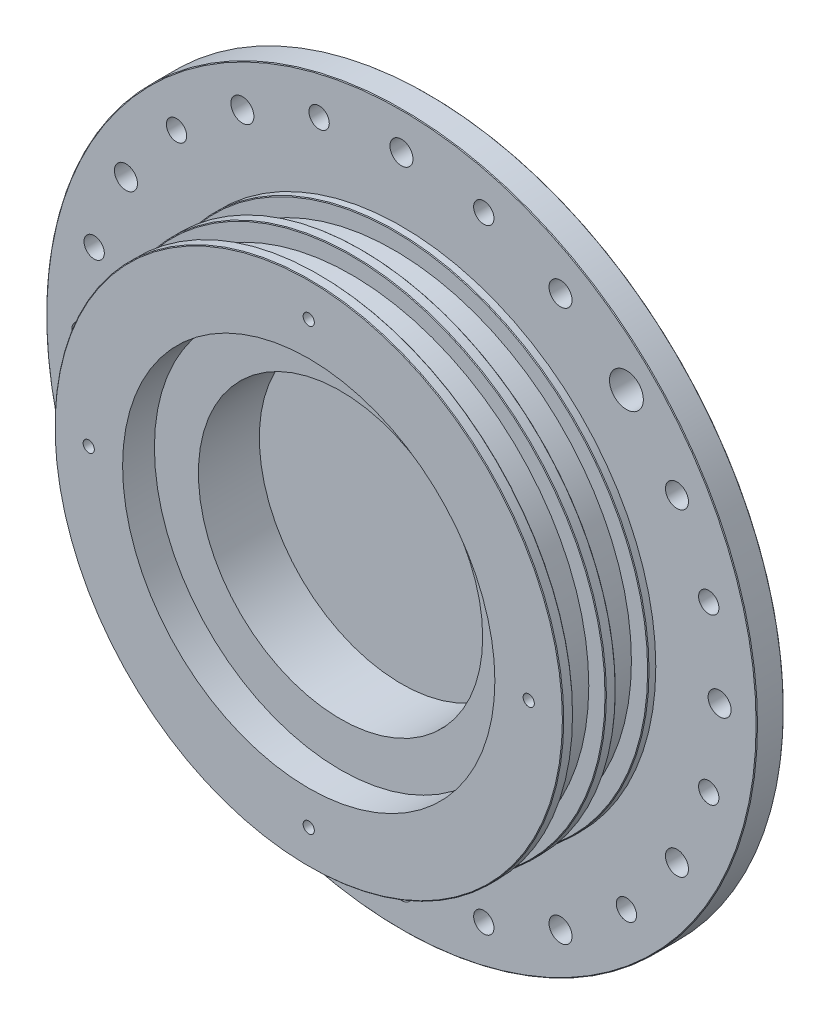
from build123d import *

# Parameters (mm, degrees)
DIAM_TRE_DU_PER_AGE_9_0_9_1_D     = 9
DIAM_TRE_DU_PER_AGE_9_0_9_1_DEPTH = 3
TROU_TARAUD_M4X0_71_D             = 3.3
TROU_TARAUD_M4X0_71_DEPTH         = 15
R_P_TITION_CIRCULAIRE3_COUNT      = 4
D_GAGEMENT_M1001_D                = 110
D_GAGEMENT_M1001_DEPTH            = 27.4
ESQUISSE8_R                       = 105
ESQUISSE8_R_2                     = 77.5
BOSS_EXTRU_1_DEPTH                = 8
ESQUISSE35_R                      = 55
ESQUISSE35_R_2                    = 42
BOSS_EXTRU_4_DEPTH                = 18
TROU_TARAUD_M8X1_251_D            = 6.8
TROU_TARAUD_M8X1_251_DEPTH        = 20
R_P_TITION_CIRCULAIRE2_COUNT      = 12
ENL_V_MAT_EXTRU_15_DEPTH          = 153.653725798
ENL_V_MAT_EXTRU_15_DEPTH_BACK     = 153.653725798
ESQUISSE24_R                      = 3
ESQUISSE24_R_2                    = 5.1
ESQUISSE24_R_3                    = 5
CHANFREIN1_SIZE                   = 0.2
ENL_V_MAT_EXTRU_18_DEPTH          = 2
BOSS_EXTRU_5_START                = -5
ESQUISSE36_R                      = 5.1
BOSS_EXTRU_5_DEPTH                = 5
R_P_TITION_CIRCULAIRE1_COUNT      = 8


with BuildPart() as part:
    # Esquisse1 → Révolution1 (revolve)
    with BuildSketch(Plane(origin=(0, 0, 0), x_dir=(1, 0, 0), z_dir=(0, 1, 0))):
        Polygon((87.5, 35.4), (0, 35.4), (0, 0), (75.15, 0), (75.15, 3), (70.15, 3), (70.15, 12.6), (75.15, 12.6), (75.15, 15.6), (70.15, 15.6), (70.15, 25.2), (75.15, 25.2), (75.15, 27.4), (87.5, 27.4), align=None)
    revolve(axis=Axis((0, 0, -35.4), (0, 0, 1)))

    # Diamètre du perçage Ø9.0 (9)1
    with Locations(Plane.XY.offset(-27.4)):
        with Locations((-87.5, 0), (0, 87.5), (0, -87.5), (87.5, 0)):
            Hole(DIAM_TRE_DU_PER_AGE_9_0_9_1_D / 2, depth=DIAM_TRE_DU_PER_AGE_9_0_9_1_DEPTH)

    # Trou taraudé M4x0.71
    with Locations(Plane.XY):
        with Locations((0, 65)):
            trou_taraud_m4x0_71 = Hole(TROU_TARAUD_M4X0_71_D / 2, depth=TROU_TARAUD_M4X0_71_DEPTH)

    # Répétition circulaire3: Trou taraudé M4x0.71 ×4 about axis
    r_p_tition_circulaire3_axis = Axis((0, 0, -35.4), (0, 0, 1))
    for i in range(1, R_P_TITION_CIRCULAIRE3_COUNT):
        add(trou_taraud_m4x0_71.rotate(r_p_tition_circulaire3_axis, i * 360 / R_P_TITION_CIRCULAIRE3_COUNT), mode=Mode.SUBTRACT)

    # Dégagement M1001
    with Locations(Plane.XY):
        with Locations((0, 0)):
            Hole(D_GAGEMENT_M1001_D / 2, depth=D_GAGEMENT_M1001_DEPTH)

    # Esquisse8 → Boss.-Extru.1 (add)
    with BuildSketch(Plane(origin=(0, 0, -35.4), x_dir=(-1, 0, 0), z_dir=(0, 0, -1))):
        Circle(ESQUISSE8_R)
        Circle(ESQUISSE8_R_2, mode=Mode.SUBTRACT)
    extrude(amount=-BOSS_EXTRU_1_DEPTH)

    # Esquisse35 → Boss.-Extru.4 (add)
    with BuildSketch(Plane.XY.offset(-27.4)):
        Circle(ESQUISSE35_R)
        Circle(ESQUISSE35_R_2, mode=Mode.SUBTRACT)
    extrude(amount=BOSS_EXTRU_4_DEPTH)

    # Trou taraudé M8x1.251
    with Locations(Plane(origin=(0, 0, -35.4), x_dir=(-1, 0, 0), z_dir=(0, 0, -1))):
        with Locations((0, -94), (0, -50)):
            trou_taraud_m8x1_251 = Hole(TROU_TARAUD_M8X1_251_D / 2, depth=TROU_TARAUD_M8X1_251_DEPTH)

    # Répétition circulaire2: Trou taraudé M8x1.251 ×12 about axis
    r_p_tition_circulaire2_axis = Axis((0, 0, -35.4), (0, 0, -1))
    for i in range(1, R_P_TITION_CIRCULAIRE2_COUNT):
        add(trou_taraud_m8x1_251.rotate(r_p_tition_circulaire2_axis, i * 360 / R_P_TITION_CIRCULAIRE2_COUNT), mode=Mode.SUBTRACT)

    # Esquisse24 → Enlèv. mat.-Extru.15 (cut, two sides: drawn at the far end of the back side and taken through both)
    with BuildSketch(Plane(origin=(0, 0, -35.4), x_dir=(-1, 0, 0), z_dir=(0, 0, -1)).offset(-ENL_V_MAT_EXTRU_15_DEPTH_BACK)):
        with Locations((24.32899024, 90.797027671)):
            Circle(ESQUISSE24_R)
        with Locations((66.468037432, 66.468037432)):
            Circle(ESQUISSE24_R)
        with Locations((90.797027671, 24.32899024)):
            Circle(ESQUISSE24_R)
        with Locations((90.797027671, -24.32899024)):
            Circle(ESQUISSE24_R)
        with Locations((-14, 24.248711306)):
            Circle(ESQUISSE24_R_2)
        with Locations((7.246933263, 27.045923136)):
            Circle(ESQUISSE24_R_2)
        with Locations((24.248711306, 14)):
            Circle(ESQUISSE24_R_2)
        with Locations((27.045923136, -7.246933263)):
            Circle(ESQUISSE24_R_2)
        with Locations((14, -24.248711306)):
            Circle(ESQUISSE24_R_2)
        with Locations((-7.246933263, -27.045923136)):
            Circle(ESQUISSE24_R_2)
        with Locations((-24.248711306, -14)):
            Circle(ESQUISSE24_R_2)
        with Locations((-27.045923136, 7.246933263)):
            Circle(ESQUISSE24_R_2)
        with Locations((-66.468037432, 66.468037432)):
            Circle(ESQUISSE24_R_3)
        with Locations((66.468037432, -66.468037432)):
            Circle(ESQUISSE24_R)
        with Locations((24.32899024, -90.797027671)):
            Circle(ESQUISSE24_R)
        with Locations((-24.32899024, -90.797027671)):
            Circle(ESQUISSE24_R)
        with Locations((-66.468037432, -66.468037432)):
            Circle(ESQUISSE24_R)
        with Locations((-90.797027671, -24.32899024)):
            Circle(ESQUISSE24_R)
        with Locations((-90.797027671, 24.32899024)):
            Circle(ESQUISSE24_R)
        with Locations((-24.32899024, 90.797027671)):
            Circle(ESQUISSE24_R)
        Circle(ESQUISSE24_R_2)
    extrude(amount=ENL_V_MAT_EXTRU_15_DEPTH + ENL_V_MAT_EXTRU_15_DEPTH_BACK, mode=Mode.SUBTRACT)

    # Chanfrein1
    chanfrein1_edges = [part.edges().sort_by_distance(p)[0] for p in [
        (-75.15, 0, -25.2),
        (-75.15, 0, -3),
        (-75.15, 0, -12.6),
        (-75.15, 0, -15.6),
        (105, 0, -35.4),
        (105, 0, -27.4),
        (-75.15, 0, 0),
    ]]
    chamfer(chanfrein1_edges, length=CHANFREIN1_SIZE)

    # Esquisse25 → Enlèv. mat.-Extru.18 (cut)
    with BuildSketch(Plane(origin=(0, 0, -35.4), x_dir=(-1, 0, 0), z_dir=(0, 0, -1))):
        with BuildLine():
            Line((-10.1, 3.137845559), (-10.1, -3.137845559))
            ThreePointArc((-10.1, -3.137845559), (-10.1, -4.604345773), (-9.404868295, -5.895629937))
            ThreePointArc((-9.404868295, -5.895629937), (0, -11.1), (9.404868295, -5.895629937))
            ThreePointArc((9.404868295, -5.895629937), (10.1, -4.604345773), (10.1, -3.137845559))
            Line((10.1, -3.137845559), (10.1, 3.137845559))
            ThreePointArc((10.1, 3.137845559), (10.1, 4.604345773), (9.404868295, 5.895629937))
            ThreePointArc((9.404868295, 5.895629937), (0, 11.1), (-9.404868295, 5.895629937))
            ThreePointArc((-9.404868295, 5.895629937), (-10.1, 4.604345773), (-10.1, 3.137845559))
        make_face()
        with BuildLine():
            Line((-22.534674305, 14.423884843), (-27.364303436, 15.717980069))
            ThreePointArc((-27.364303436, 15.717980069), (-27.626062148, 15.80113362), (-27.879119212, 15.907877515))
            ThreePointArc((-27.879119212, 15.907877515), (-29.43732897, 16.188098003), (-30.921195595, 15.636118826))
            ThreePointArc((-30.921195595, 15.636118826), (-31.100803738, 15.516590499), (-31.288537773, 15.410279455))
            ThreePointArc((-31.288537773, 15.410279455), (-35.932440738, 9.628068478), (-34.801808286, 2.298575399))
            ThreePointArc((-34.801808286, 2.298575399), (-34.692381365, 2.112640317), (-34.596600313, 1.919321678))
            ThreePointArc((-34.596600313, 1.919321678), (-33.587523709, 0.699360376), (-32.09796423, 0.162933558))
            ThreePointArc((-32.09796423, 0.162933558), (-31.825438437, 0.128847951), (-31.557171967, 0.069981683))
            Line((-31.557171967, 0.069981683), (-26.727542836, -1.224113543))
            ThreePointArc((-26.727542836, -1.224113543), (-26.465784124, -1.307267094), (-26.212727061, -1.414010989))
            ThreePointArc((-26.212727061, -1.414010989), (-24.654517302, -1.694231477), (-23.170650678, -1.1422523))
            ThreePointArc((-23.170650678, -1.1422523), (-22.991042534, -1.022723973), (-22.803308499, -0.916412929))
            ThreePointArc((-22.803308499, -0.916412929), (-18.159405534, 4.865798048), (-19.290037986, 12.195291126))
            ThreePointArc((-19.290037986, 12.195291126), (-19.399464908, 12.381226209), (-19.495245959, 12.574544848))
            ThreePointArc((-19.495245959, 12.574544848), (-20.504322564, 13.79450615), (-21.993882042, 14.330932968))
            ThreePointArc((-21.993882042, 14.330932968), (-22.266407835, 14.365018575), (-22.534674305, 14.423884843))
        make_face()
        with BuildLine():
            Line((-5.735194229, 26.133647797), (-8.235194229, 30.463774815))
            ThreePointArc((-8.235194229, 30.463774815), (-8.36148715, 30.707664616), (-8.464946183, 30.962082313))
            ThreePointArc((-8.464946183, 30.962082313), (-9.368621062, 32.262048807), (-10.808181434, 32.92099274))
            ThreePointArc((-10.808181434, 32.92099274), (-11.019702861, 32.963475586), (-11.22762413, 33.021050335))
            ThreePointArc((-11.22762413, 33.021050335), (-18.6, 32.216145021), (-22.983256384, 26.233932888))
            ThreePointArc((-22.983256384, 26.233932888), (-23.037355824, 26.025080413), (-23.106325314, 25.820656061))
            ThreePointArc((-23.106325314, 25.820656061), (-23.255443313, 24.244488242), (-22.581476746, 22.811899593))
            ThreePointArc((-22.581476746, 22.811899593), (-22.412874073, 22.595092593), (-22.264805771, 22.363774815))
            Line((-22.264805771, 22.363774815), (-19.764805771, 18.033647797))
            ThreePointArc((-19.764805771, 18.033647797), (-19.63851285, 17.789757996), (-19.535053817, 17.535340299))
            ThreePointArc((-19.535053817, 17.535340299), (-18.631378938, 16.235373805), (-17.191818566, 15.576429871))
            ThreePointArc((-17.191818566, 15.576429871), (-16.980297139, 15.533947026), (-16.77237587, 15.476372277))
            ThreePointArc((-16.77237587, 15.476372277), (-9.4, 16.281277591), (-5.016743616, 22.263489724))
            ThreePointArc((-5.016743616, 22.263489724), (-4.962644176, 22.472342199), (-4.893674686, 22.676766551))
            ThreePointArc((-4.893674686, 22.676766551), (-4.744556687, 24.25293437), (-5.418523254, 25.685523019))
            ThreePointArc((-5.418523254, 25.685523019), (-5.587125927, 25.902330019), (-5.735194229, 26.133647797))
        make_face()
        with BuildLine():
            Line((14.423884843, 22.534674305), (15.717980069, 27.364303436))
            ThreePointArc((15.717980069, 27.364303436), (15.80113362, 27.626062148), (15.907877515, 27.879119212))
            ThreePointArc((15.907877515, 27.879119212), (16.188098003, 29.43732897), (15.636118826, 30.921195595))
            ThreePointArc((15.636118826, 30.921195595), (15.516590499, 31.100803738), (15.410279455, 31.288537773))
            ThreePointArc((15.410279455, 31.288537773), (9.628068478, 35.932440738), (2.298575399, 34.801808286))
            ThreePointArc((2.298575399, 34.801808286), (2.112640317, 34.692381365), (1.919321678, 34.596600313))
            ThreePointArc((1.919321678, 34.596600313), (0.699360376, 33.587523709), (0.162933558, 32.09796423))
            ThreePointArc((0.162933558, 32.09796423), (0.128847951, 31.825438437), (0.069981683, 31.557171967))
            Line((0.069981683, 31.557171967), (-1.224113543, 26.727542836))
            ThreePointArc((-1.224113543, 26.727542836), (-1.307267094, 26.465784124), (-1.414010989, 26.212727061))
            ThreePointArc((-1.414010989, 26.212727061), (-1.694231477, 24.654517302), (-1.1422523, 23.170650678))
            ThreePointArc((-1.1422523, 23.170650678), (-1.022723973, 22.991042534), (-0.916412929, 22.803308499))
            ThreePointArc((-0.916412929, 22.803308499), (4.865798048, 18.159405534), (12.195291126, 19.290037986))
            ThreePointArc((12.195291126, 19.290037986), (12.381226209, 19.399464908), (12.574544848, 19.495245959))
            ThreePointArc((12.574544848, 19.495245959), (13.79450615, 20.504322564), (14.330932968, 21.993882042))
            ThreePointArc((14.330932968, 21.993882042), (14.365018575, 22.266407835), (14.423884843, 22.534674305))
        make_face()
        with BuildLine():
            Line((26.133647797, 5.735194229), (30.463774815, 8.235194229))
            ThreePointArc((30.463774815, 8.235194229), (30.707664616, 8.36148715), (30.962082313, 8.464946183))
            ThreePointArc((30.962082313, 8.464946183), (32.262048807, 9.368621062), (32.92099274, 10.808181434))
            ThreePointArc((32.92099274, 10.808181434), (32.963475586, 11.019702861), (33.021050335, 11.22762413))
            ThreePointArc((33.021050335, 11.22762413), (32.216145021, 18.6), (26.233932888, 22.983256384))
            ThreePointArc((26.233932888, 22.983256384), (26.025080413, 23.037355824), (25.820656061, 23.106325314))
            ThreePointArc((25.820656061, 23.106325314), (24.244488242, 23.255443313), (22.811899593, 22.581476746))
            ThreePointArc((22.811899593, 22.581476746), (22.595092593, 22.412874073), (22.363774815, 22.264805771))
            Line((22.363774815, 22.264805771), (18.033647797, 19.764805771))
            ThreePointArc((18.033647797, 19.764805771), (17.789757996, 19.63851285), (17.535340299, 19.535053817))
            ThreePointArc((17.535340299, 19.535053817), (16.235373805, 18.631378938), (15.576429871, 17.191818566))
            ThreePointArc((15.576429871, 17.191818566), (15.533947026, 16.980297139), (15.476372277, 16.77237587))
            ThreePointArc((15.476372277, 16.77237587), (16.281277591, 9.4), (22.263489724, 5.016743616))
            ThreePointArc((22.263489724, 5.016743616), (22.472342199, 4.962644176), (22.676766551, 4.893674686))
            ThreePointArc((22.676766551, 4.893674686), (24.25293437, 4.744556687), (25.685523019, 5.418523254))
            ThreePointArc((25.685523019, 5.418523254), (25.902330019, 5.587125927), (26.133647797, 5.735194229))
        make_face()
        with BuildLine():
            Line((22.534674305, -14.423884843), (27.364303436, -15.717980069))
            ThreePointArc((27.364303436, -15.717980069), (27.626062148, -15.80113362), (27.879119212, -15.907877515))
            ThreePointArc((27.879119212, -15.907877515), (29.43732897, -16.188098003), (30.921195595, -15.636118826))
            ThreePointArc((30.921195595, -15.636118826), (31.100803738, -15.516590499), (31.288537773, -15.410279455))
            ThreePointArc((31.288537773, -15.410279455), (35.932440738, -9.628068478), (34.801808286, -2.298575399))
            ThreePointArc((34.801808286, -2.298575399), (34.692381365, -2.112640317), (34.596600313, -1.919321678))
            ThreePointArc((34.596600313, -1.919321678), (33.587523709, -0.699360376), (32.09796423, -0.162933558))
            ThreePointArc((32.09796423, -0.162933558), (31.825438437, -0.128847951), (31.557171967, -0.069981683))
            Line((31.557171967, -0.069981683), (26.727542836, 1.224113543))
            ThreePointArc((26.727542836, 1.224113543), (26.465784124, 1.307267094), (26.212727061, 1.414010989))
            ThreePointArc((26.212727061, 1.414010989), (24.654517302, 1.694231477), (23.170650678, 1.1422523))
            ThreePointArc((23.170650678, 1.1422523), (22.991042534, 1.022723973), (22.803308499, 0.916412929))
            ThreePointArc((22.803308499, 0.916412929), (18.159405534, -4.865798048), (19.290037986, -12.195291126))
            ThreePointArc((19.290037986, -12.195291126), (19.399464908, -12.381226209), (19.495245959, -12.574544848))
            ThreePointArc((19.495245959, -12.574544848), (20.504322564, -13.79450615), (21.993882042, -14.330932968))
            ThreePointArc((21.993882042, -14.330932968), (22.266407835, -14.365018575), (22.534674305, -14.423884843))
        make_face()
        with BuildLine():
            Line((5.735194229, -26.133647797), (8.235194229, -30.463774815))
            ThreePointArc((8.235194229, -30.463774815), (8.36148715, -30.707664616), (8.464946183, -30.962082313))
            ThreePointArc((8.464946183, -30.962082313), (9.368621062, -32.262048807), (10.808181434, -32.92099274))
            ThreePointArc((10.808181434, -32.92099274), (11.019702861, -32.963475586), (11.22762413, -33.021050335))
            ThreePointArc((11.22762413, -33.021050335), (18.6, -32.216145021), (22.983256384, -26.233932888))
            ThreePointArc((22.983256384, -26.233932888), (23.037355824, -26.025080413), (23.106325314, -25.820656061))
            ThreePointArc((23.106325314, -25.820656061), (23.255443313, -24.244488242), (22.581476746, -22.811899593))
            ThreePointArc((22.581476746, -22.811899593), (22.412874073, -22.595092593), (22.264805771, -22.363774815))
            Line((22.264805771, -22.363774815), (19.764805771, -18.033647797))
            ThreePointArc((19.764805771, -18.033647797), (19.63851285, -17.789757996), (19.535053817, -17.535340299))
            ThreePointArc((19.535053817, -17.535340299), (18.631378938, -16.235373805), (17.191818566, -15.576429871))
            ThreePointArc((17.191818566, -15.576429871), (16.980297139, -15.533947026), (16.77237587, -15.476372277))
            ThreePointArc((16.77237587, -15.476372277), (9.4, -16.281277591), (5.016743616, -22.263489724))
            ThreePointArc((5.016743616, -22.263489724), (4.962644176, -22.472342199), (4.893674686, -22.676766551))
            ThreePointArc((4.893674686, -22.676766551), (4.744556687, -24.25293437), (5.418523254, -25.685523019))
            ThreePointArc((5.418523254, -25.685523019), (5.587125927, -25.902330019), (5.735194229, -26.133647797))
        make_face()
        with BuildLine():
            Line((-14.423884843, -22.534674305), (-15.717980069, -27.364303436))
            ThreePointArc((-15.717980069, -27.364303436), (-15.80113362, -27.626062148), (-15.907877515, -27.879119212))
            ThreePointArc((-15.907877515, -27.879119212), (-16.188098003, -29.43732897), (-15.636118826, -30.921195595))
            ThreePointArc((-15.636118826, -30.921195595), (-15.516590499, -31.100803738), (-15.410279455, -31.288537773))
            ThreePointArc((-15.410279455, -31.288537773), (-9.628068478, -35.932440738), (-2.298575399, -34.801808286))
            ThreePointArc((-2.298575399, -34.801808286), (-2.112640317, -34.692381365), (-1.919321678, -34.596600313))
            ThreePointArc((-1.919321678, -34.596600313), (-0.699360376, -33.587523709), (-0.162933558, -32.09796423))
            ThreePointArc((-0.162933558, -32.09796423), (-0.128847951, -31.825438437), (-0.069981683, -31.557171967))
            Line((-0.069981683, -31.557171967), (1.224113543, -26.727542836))
            ThreePointArc((1.224113543, -26.727542836), (1.307267094, -26.465784124), (1.414010989, -26.212727061))
            ThreePointArc((1.414010989, -26.212727061), (1.694231477, -24.654517302), (1.1422523, -23.170650678))
            ThreePointArc((1.1422523, -23.170650678), (1.022723973, -22.991042534), (0.916412929, -22.803308499))
            ThreePointArc((0.916412929, -22.803308499), (-4.865798048, -18.159405534), (-12.195291126, -19.290037986))
            ThreePointArc((-12.195291126, -19.290037986), (-12.381226209, -19.399464908), (-12.574544848, -19.495245959))
            ThreePointArc((-12.574544848, -19.495245959), (-13.79450615, -20.504322564), (-14.330932968, -21.993882042))
            ThreePointArc((-14.330932968, -21.993882042), (-14.365018575, -22.266407835), (-14.423884843, -22.534674305))
        make_face()
        with BuildLine():
            Line((-26.133647797, -5.735194229), (-30.463774815, -8.235194229))
            ThreePointArc((-30.463774815, -8.235194229), (-30.707664616, -8.36148715), (-30.962082313, -8.464946183))
            ThreePointArc((-30.962082313, -8.464946183), (-32.262048807, -9.368621062), (-32.92099274, -10.808181434))
            ThreePointArc((-32.92099274, -10.808181434), (-32.963475586, -11.019702861), (-33.021050335, -11.22762413))
            ThreePointArc((-33.021050335, -11.22762413), (-32.216145021, -18.6), (-26.233932888, -22.983256384))
            ThreePointArc((-26.233932888, -22.983256384), (-26.025080413, -23.037355824), (-25.820656061, -23.106325314))
            ThreePointArc((-25.820656061, -23.106325314), (-24.244488242, -23.255443313), (-22.811899593, -22.581476746))
            ThreePointArc((-22.811899593, -22.581476746), (-22.595092593, -22.412874073), (-22.363774815, -22.264805771))
            Line((-22.363774815, -22.264805771), (-18.033647797, -19.764805771))
            ThreePointArc((-18.033647797, -19.764805771), (-17.789757996, -19.63851285), (-17.535340299, -19.535053817))
            ThreePointArc((-17.535340299, -19.535053817), (-16.235373805, -18.631378938), (-15.576429871, -17.191818566))
            ThreePointArc((-15.576429871, -17.191818566), (-15.533947026, -16.980297139), (-15.476372277, -16.77237587))
            ThreePointArc((-15.476372277, -16.77237587), (-16.281277591, -9.4), (-22.263489724, -5.016743616))
            ThreePointArc((-22.263489724, -5.016743616), (-22.472342199, -4.962644176), (-22.676766551, -4.893674686))
            ThreePointArc((-22.676766551, -4.893674686), (-24.25293437, -4.744556687), (-25.685523019, -5.418523254))
            ThreePointArc((-25.685523019, -5.418523254), (-25.902330019, -5.587125927), (-26.133647797, -5.735194229))
        make_face()
    extrude(amount=-ENL_V_MAT_EXTRU_18_DEPTH, mode=Mode.SUBTRACT)

    # Esquisse36 → Boss.-Extru.5 (add)
    with BuildSketch(Plane.XY.offset(-27.4).offset(BOSS_EXTRU_5_START)):
        with Locations((-27.045923136, -7.246933263)):
            Circle(ESQUISSE36_R)
        with Locations((-24.248711306, 14)):
            Circle(ESQUISSE36_R)
        with Locations((-7.246933263, 27.045923136)):
            Circle(ESQUISSE36_R)
        with Locations((14, 24.248711306)):
            Circle(ESQUISSE36_R)
        with Locations((27.045923136, 7.246933263)):
            Circle(ESQUISSE36_R)
        with Locations((24.248711306, -14)):
            Circle(ESQUISSE36_R)
        with Locations((7.246933263, -27.045923136)):
            Circle(ESQUISSE36_R)
        with Locations((-14, -24.248711306)):
            Circle(ESQUISSE36_R)
        Circle(ESQUISSE36_R)
    extrude(amount=BOSS_EXTRU_5_DEPTH)

    # Esquisse38 → Enlèvement de matière-Révolution4 (revolve, cut)
    with BuildSketch(Plane(origin=(0, 0, 0), x_dir=(0, 0, 1), z_dir=(-0.8660254037844345, 0.500000000000007, 0))):
        Polygon((-35.4, 28), (-30.4, 28), (-32.4, 33.1), (-35.4, 33.1), align=None)
    enl_vement_de_mati_re_r_volution4 = revolve(axis=Axis((14, 24.248711306, -35.4), (0, 0, 1)), mode=Mode.SUBTRACT)

    # Répétition circulaire1: Enlèvement de matière-Révolution4 ×8 about axis
    r_p_tition_circulaire1_axis = Axis((0, 0, -32.4), (0, 0, -1))
    for i in range(1, R_P_TITION_CIRCULAIRE1_COUNT):
        add(enl_vement_de_mati_re_r_volution4.rotate(r_p_tition_circulaire1_axis, i * 360 / R_P_TITION_CIRCULAIRE1_COUNT), mode=Mode.SUBTRACT)

    # Esquisse39 → Enlèvement de matière-Révolution5 (revolve, cut)
    with BuildSketch(Plane(origin=(0, 0, 0), x_dir=(0, 0, 1), z_dir=(-0.8660254037844345, 0.500000000000007, 0))):
        Polygon((-35.4, 0), (-35.4, 7.1), (-32.4, 7.1), (-30.4, 0), align=None)
    revolve(axis=Axis((0, 0, 0), (0, 0, -1)), mode=Mode.SUBTRACT)


solid = part.part
